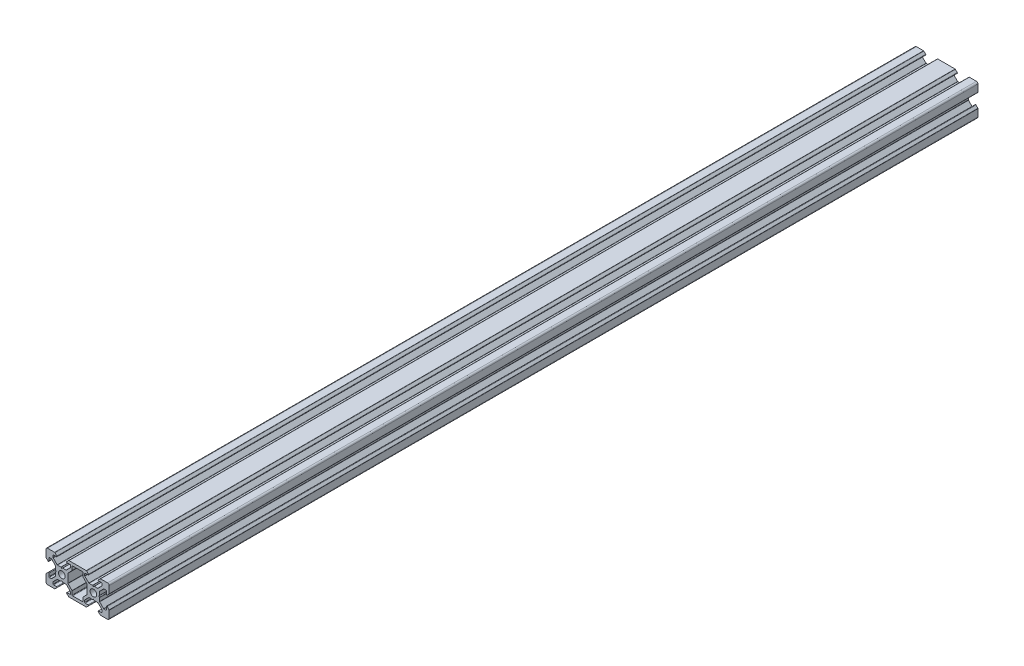
from build123d import *

# Parameters (mm, degrees)
SKETCH_1_R      = 2.1
EXTRUDE_1_DEPTH = 550
FILLET_1_R      = 1
FILLET_2_R      = 0.3


with BuildPart() as part:
    # Эскиз1 → Бобышка-Вытянуть1 (new body)
    with BuildSketch(Plane.XY):
        Polygon((-10, -10), (-10, -4.4), (-8.2, -2.6), (-8.2, -5.499339828), (-6.56, -5.499339828), (-3.900660172, -2.84), (-3.900660172, -0.5), (-3.400660172, 0), (-3.900660172, 0.5), (-3.900660172, 2.84), (-6.56, 5.499339828), (-8.2, 5.499339828), (-8.2, 2.6), (-10, 4.4), (-10, 10), (-4.4, 10), (-2.6, 8.2), (-5.499339828, 8.2), (-5.499339828, 6.56), (-2.84, 3.900660172), (-0.5, 3.900660172), (0, 3.400660172), (0.5, 3.900660172), (2.84, 3.900660172), (5.499339828, 6.56), (5.499339828, 8.2), (2.6, 8.2), (4.4, 10), (15.6, 10), (17.4, 8.2), (14.500660172, 8.2), (14.500660172, 6.56), (17.16, 3.900660172), (19.5, 3.900660172), (20, 3.400660172), (20.5, 3.900660172), (22.84, 3.900660172), (25.499339828, 6.56), (25.499339828, 8.2), (22.6, 8.2), (24.4, 10), (30, 10), (30, 4.4), (28.2, 2.6), (28.2, 5.499339828), (26.56, 5.499339828), (23.900660172, 2.84), (23.900660172, 0.5), (23.400660172, 0), (23.900660172, -0.5), (23.900660172, -2.84), (26.56, -5.499339828), (28.2, -5.499339828), (28.2, -2.6), (30, -4.4), (30, -10), (24.4, -10), (22.6, -8.2), (25.499339828, -8.2), (25.499339828, -6.56), (22.84, -3.900660172), (20.5, -3.900660172), (20, -3.400660172), (19.5, -3.900660172), (17.16, -3.900660172), (14.500660172, -6.56), (14.500660172, -8.2), (17.4, -8.2), (15.6, -10), (4.4, -10), (2.6, -8.2), (5.499339828, -8.2), (5.499339828, -6.56), (2.84, -3.900660172), (0.5, -3.900660172), (0, -3.400660172), (-0.5, -3.900660172), (-2.84, -3.900660172), (-5.499339828, -6.56), (-5.499339828, -8.2), (-2.6, -8.2), (-4.4, -10), align=None)
        Circle(SKETCH_1_R, mode=Mode.SUBTRACT)
        with Locations((20, 0)):
            Circle(SKETCH_1_R, mode=Mode.SUBTRACT)
        Polygon((3.900660172, -0.5), (3.900660172, 0.5), (3.900660172, 2.84), (6.56, 5.499339828), (6.56, 8.2), (13.44, 8.2), (13.44, 5.499339828), (16.099339828, 2.84), (16.099339828, 0.5), (16.099339828, -0.5), (16.099339828, -2.84), (13.44, -5.499339828), (13.44, -8.2), (6.56, -8.2), (6.56, -5.499339828), (3.900660172, -2.84), align=None, mode=Mode.SUBTRACT)
    extrude(amount=EXTRUDE_1_DEPTH)

    # Скругление1
    fillet_1_edges = [part.edges().sort_by_distance(p)[0] for p in [
        (-10, 10, 275),
        (-10, -10, 275),
        (30, 10, 275),
        (30, -10, 275),
    ]]
    fillet(fillet_1_edges, radius=FILLET_1_R)

    # Скругление2
    fillet_2_edges = [part.edges().sort_by_distance(p)[0] for p in [
        (-4.4, 10, 275),
        (-2.6, 8.2, 275),
        (-5.499339828, 8.2, 275),
        (-5.499339828, 6.56, 275),
        (-2.84, 3.900660172, 275),
        (-0.5, 3.900660172, 275),
        (0.5, 3.900660172, 275),
        (2.84, 3.900660172, 275),
        (5.499339828, 6.56, 275),
        (4.4, 10, 275),
        (5.499339828, 8.2, 275),
        (2.6, 8.2, 275),
        (3.900660172, 2.84, 275),
        (3.900660172, -2.84, 275),
        (4.4, -10, 275),
        (2.6, -8.2, 275),
        (5.499339828, -8.2, 275),
        (5.499339828, -6.56, 275),
        (2.84, -3.900660172, 275),
        (0.5, -3.900660172, 275),
        (-0.5, -3.900660172, 275),
        (-2.84, -3.900660172, 275),
        (-5.499339828, -6.56, 275),
        (-5.499339828, -8.2, 275),
        (-2.6, -8.2, 275),
        (-10, -4.4, 275),
        (-8.2, -2.6, 275),
        (-8.2, -5.499339828, 275),
        (-6.56, -5.499339828, 275),
        (-3.900660172, -2.84, 275),
        (-3.900660172, -0.5, 275),
        (-3.900660172, 0.5, 275),
        (-3.900660172, 2.84, 275),
        (-6.56, 5.499339828, 275),
        (-8.2, 5.499339828, 275),
        (-8.2, 2.6, 275),
        (-10, 4.4, 275),
        (6.56, -5.499339828, 275),
        (6.56, 5.499339828, 275),
        (6.56, 8.2, 275),
        (13.44, 8.2, 275),
        (13.44, 5.499339828, 275),
        (16.099339828, 2.84, 275),
        (16.099339828, -2.84, 275),
        (13.44, -5.499339828, 275),
        (13.44, -8.2, 275),
        (6.56, -8.2, 275),
        (15.6, 10, 275),
        (17.4, 8.2, 275),
        (14.500660172, 8.2, 275),
        (14.500660172, 6.56, 275),
        (17.16, 3.900660172, 275),
        (19.5, 3.900660172, 275),
        (20.5, 3.900660172, 275),
        (22.84, 3.900660172, 275),
        (25.499339828, 6.56, 275),
        (25.499339828, 8.2, 275),
        (22.6, 8.2, 275),
        (24.4, 10, 275),
        (30, 4.4, 275),
        (28.2, 2.6, 275),
        (28.2, 5.499339828, 275),
        (26.56, 5.499339828, 275),
        (23.900660172, 2.84, 275),
        (23.900660172, 0.5, 275),
        (23.900660172, -0.5, 275),
        (23.900660172, -2.84, 275),
        (26.56, -5.499339828, 275),
        (28.2, -5.499339828, 275),
        (28.2, -2.6, 275),
        (30, -4.4, 275),
        (24.4, -10, 275),
        (22.6, -8.2, 275),
        (25.499339828, -8.2, 275),
        (25.499339828, -6.56, 275),
        (22.84, -3.900660172, 275),
        (20.5, -3.900660172, 275),
        (19.5, -3.900660172, 275),
        (17.16, -3.900660172, 275),
        (14.500660172, -6.56, 275),
        (14.500660172, -8.2, 275),
        (17.4, -8.2, 275),
        (15.6, -10, 275),
    ]]
    fillet(fillet_2_edges, radius=FILLET_2_R)


solid = part.part
